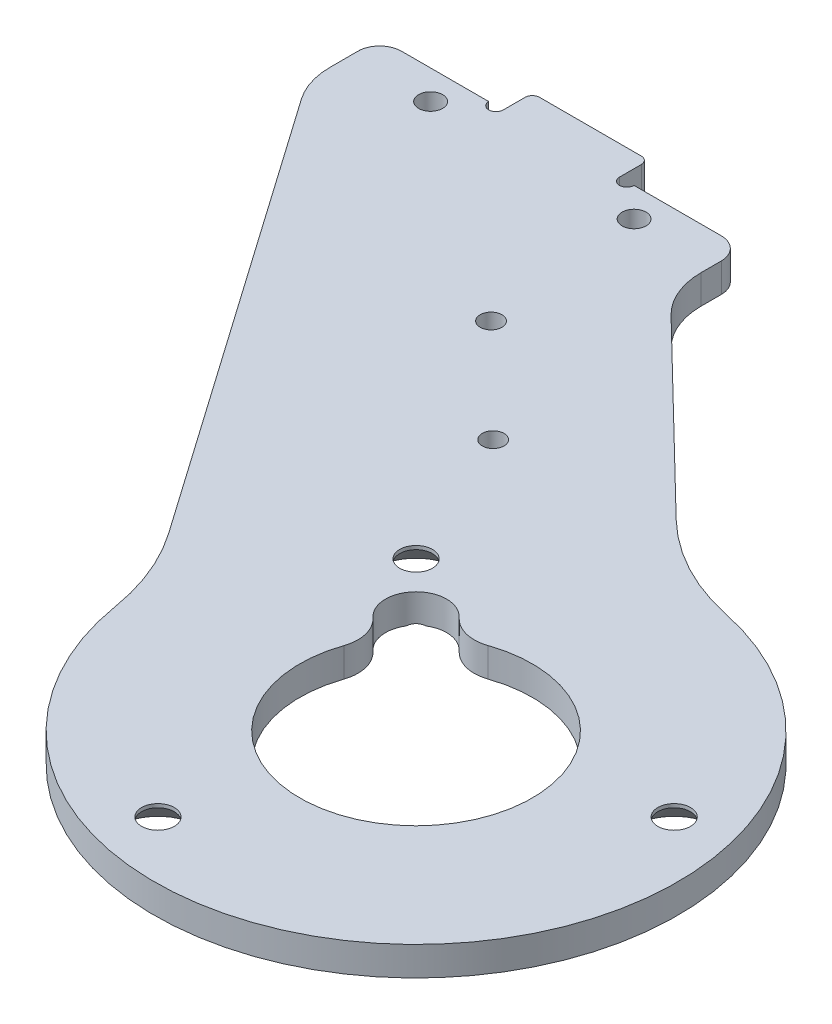
from build123d import *

# Parameters (mm, degrees)
EXTRUDE_1_DEPTH     = 4
FILLET_1_R          = 30
FILLET_2_R          = 30
SKETCH_2_R          = 2.25
SKETCH_2_R_2        = 16
CUT_EXTRUDE_1_DEPTH = 4
SKETCH_3_R          = 4.2
CUT_EXTRUDE_2_DEPTH = 4
FILLET_3_R          = 5
SKETCH_4_R          = 1.65
CUT_EXTRUDE_3_DEPTH = 4
FILLET_4_R          = 10
FILLET_5_R          = 3
SKETCH_7_W          = 16
SKETCH_7_H          = 4
EXTRUDE_3_DEPTH     = 4
CUT_EXTRUDE_5_DEPTH = 4
FILLET_7_R          = 1
CHAMFER_1_SIZE      = 3.5
SKETCH_9_R          = 1.2
CUT_EXTRUDE_6_DEPTH = 10
SKETCH_10_R         = 1.5
CUT_EXTRUDE_7_DEPTH = 10


with BuildPart() as part:
    # 草图1 → 凸台-拉伸1 (new body)
    with BuildSketch(Plane(origin=(0, 0, 0), x_dir=(1, 0, 0), z_dir=(0, 1, 0))):
        with BuildLine():
            Line((-85, 80), (-35, 80))
            Line((-35, 80), (-35, 70))
            Line((-35, 70), (0, 36))
            ThreePointArc((0, 36), (25.455844123, -25.455844123), (-36, 0))
            Line((-36, 0), (-85, 70))
            Line((-85, 70), (-85, 80))
        make_face()
    extrude(amount=EXTRUDE_1_DEPTH)

    # 圆角1
    fillet_1_edges = [part.edges().sort_by_distance(p)[0] for p in [
        (0, 2, -36),
    ]]
    fillet(fillet_1_edges, radius=FILLET_1_R)

    # 圆角2
    fillet_2_edges = [part.edges().sort_by_distance(p)[0] for p in [
        (-36, 2, 0),
    ]]
    fillet(fillet_2_edges, radius=FILLET_2_R)

    # 草图2 → 切除-拉伸1 (cut)
    with BuildSketch(Plane(origin=(0, 4, 0), x_dir=(1, 0, 0), z_dir=(0, 1, 0))):
        with Locations(Location((-20.506096654, 20.506096654, 0), (0, 0, 270))):
            Circle(SKETCH_2_R)
        with Locations(Location((28.011848962, 7.505752308, 0), (0, 0, 270))):
            Circle(SKETCH_2_R)
        with Locations(Location((-7.505752308, -28.011848962, 0), (0, 0, 270))):
            Circle(SKETCH_2_R)
        with Locations(Location((0, 0, 0), (0, 0, 270))):
            Circle(SKETCH_2_R_2)
    extrude(amount=-CUT_EXTRUDE_1_DEPTH, mode=Mode.SUBTRACT)

    # 草图3 → 切除-拉伸2 (cut)
    with BuildSketch(Plane(origin=(0, 4, 0), x_dir=(1, 0, 0), z_dir=(0, 1, 0))):
        with Locations((-13.611805538, 13.611805538)):
            Circle(SKETCH_3_R)
    extrude(amount=-CUT_EXTRUDE_2_DEPTH, mode=Mode.SUBTRACT)

    # 圆角3
    fillet_3_edges = [part.edges().sort_by_distance(p)[0] for p in [
        (-9.473632004, 2, -12.893808462),
        (-12.893808462, 2, -9.473632004),
    ]]
    fillet(fillet_3_edges, radius=FILLET_3_R)

    # 草图4 → 切除-拉伸3 (cut)
    with BuildSketch(Plane(origin=(0, 4, 0), x_dir=(1, 0, 0), z_dir=(0, 1, 0))):
        with Locations(Location((-46, 76, 0), (0, 0, 270))):
            Circle(SKETCH_4_R)
        with Locations(Location((-74, 76, 0), (0, 0, 90))):
            Circle(SKETCH_4_R)
    extrude(amount=-CUT_EXTRUDE_3_DEPTH, mode=Mode.SUBTRACT)

    # 圆角4
    fillet_4_edges = [part.edges().sort_by_distance(p)[0] for p in [
        (-35, 2, -70),
        (-85, 2, -70),
    ]]
    fillet(fillet_4_edges, radius=FILLET_4_R)

    # 圆角5
    fillet_5_edges = [part.edges().sort_by_distance(p)[0] for p in [
        (-85, 2, -80),
        (-35, 2, -80),
    ]]
    fillet(fillet_5_edges, radius=FILLET_5_R)

    # 草图7 → 凸台-拉伸3 (add)
    with BuildSketch(Plane(origin=(0, 4, 0), x_dir=(1, 0, 0), z_dir=(0, 1, 0))):
        with Locations((-60, 82)):
            Rectangle(SKETCH_7_W, SKETCH_7_H)
    extrude(amount=-EXTRUDE_3_DEPTH)

    # 草图8 → 切除-拉伸5 (cut)
    with BuildSketch(Plane(origin=(0, 4, 0), x_dir=(1, 0, 0), z_dir=(0, 1, 0))):
        with BuildLine():
            Line((-50, 80), (-52, 80))
            ThreePointArc((-52, 80), (-51, 79), (-50, 80))
        make_face()
        with BuildLine():
            Line((-70, 80), (-68, 80))
            ThreePointArc((-68, 80), (-69, 79), (-70, 80))
        make_face()
    extrude(amount=-CUT_EXTRUDE_5_DEPTH, mode=Mode.SUBTRACT)

    # 圆角7
    fillet_7_edges = [part.edges().sort_by_distance(p)[0] for p in [
        (-52, 2, -84),
        (-68, 2, -84),
    ]]
    fillet(fillet_7_edges, radius=FILLET_7_R)

    # 倒角1
    # the kernel refuses this chamfer: 3.5 mm, written as the material it takes off along each edge
    with BuildSketch(Plane(origin=(-20.506096654, 0, -20.506096654), x_dir=(0, 0, 1), z_dir=(-1, 0, 0))) as chamfer_1_piece_1:
        Polygon((2.25 + CHAMFER_1_SIZE, 0), (2.25, CHAMFER_1_SIZE), (2.25, 0), align=None)
    revolve(axis=Axis((-20.506096654, 0, -20.506096654), (0, 1, 0)), mode=Mode.SUBTRACT)
    with BuildSketch(Plane(origin=(28.011848962, 0, -7.505752308), x_dir=(0, 0, 1), z_dir=(-1, 0, 0))) as chamfer_1_piece_2:
        Polygon((2.25 + CHAMFER_1_SIZE, 0), (2.25, CHAMFER_1_SIZE), (2.25, 0), align=None)
    revolve(axis=Axis((28.011848962, 0, -7.505752308), (0, 1, 0)), mode=Mode.SUBTRACT)
    with BuildSketch(Plane(origin=(-7.505752308, 0, 28.011848962), x_dir=(0, 0, 1), z_dir=(-1, 0, 0))) as chamfer_1_piece_3:
        Polygon((2.25 + CHAMFER_1_SIZE, 0), (2.25, CHAMFER_1_SIZE), (2.25, 0), align=None)
    revolve(axis=Axis((-7.505752308, 0, 28.011848962), (0, 1, 0)), mode=Mode.SUBTRACT)

    # 草图9 → 切除-拉伸6 (cut)
    with BuildSketch(Plane.XZ):
        with Locations(Location((-29.401166302, -40.007142113, 0), (0, 0, 270))):
            Circle(SKETCH_9_R)
        with Locations(Location((-43.686880588, -54.004226358, 0), (0, 0, 270))):
            Circle(SKETCH_9_R)
    extrude(amount=-CUT_EXTRUDE_6_DEPTH, mode=Mode.SUBTRACT)

    # 草图10 → 切除-拉伸7 (cut)
    with BuildSketch(Plane.XZ):
        with Locations(Location((-29.401166302, -40.007142113, 0), (0, 0, 270))):
            Circle(SKETCH_10_R)
        with Locations(Location((-43.686880588, -54.004226358, 0), (0, 0, 270))):
            Circle(SKETCH_10_R)
    extrude(amount=-CUT_EXTRUDE_7_DEPTH, mode=Mode.SUBTRACT)


solid = part.part
